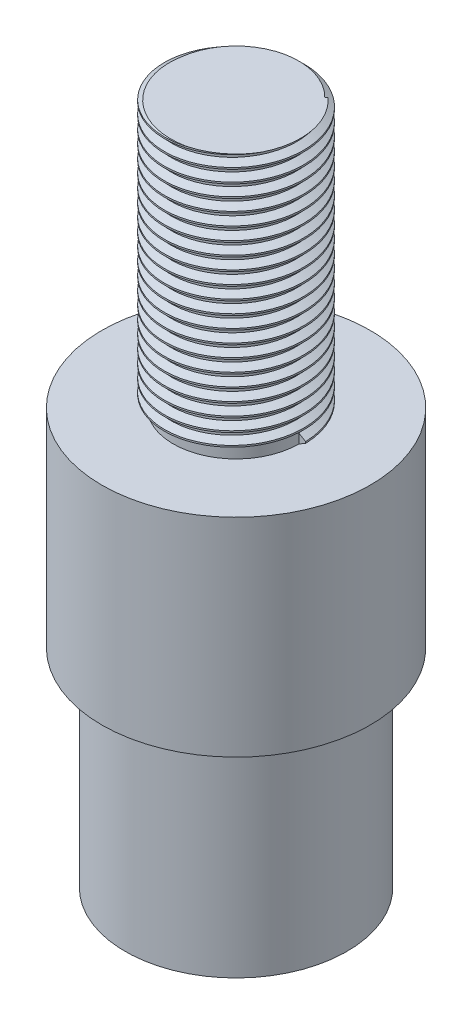
from build123d import *
from build123d.topology import SkipClean

# Parameters (mm, degrees)
SKETCH1_R           = 13.4493
BOSS_EXTRUDE1_DEPTH = 20.828
SKETCH2_R           = 11.1125
BOSS_EXTRUDE2_DEPTH = 20.828
SKETCH3_R           = 6.29285
BOSS_EXTRUDE3_DEPTH = 26.9621
THREAD1_PITCH       = 1.27
THREAD1_TO          = 26.9621


with BuildPart() as part:
    # Sketch1 → Boss-Extrude1 (new body)
    with BuildSketch(Plane(origin=(0, 0, 0), x_dir=(1, 0, 0), z_dir=(0, 1, 0))):
        with Locations(Location((0, 0, 0), (0, 0, 270))):
            Circle(SKETCH1_R)
    extrude(amount=BOSS_EXTRUDE1_DEPTH)

    # Sketch2 → Boss-Extrude2 (add)
    with BuildSketch(Plane(origin=(0, 0, 0), x_dir=(-1, 0, 0), z_dir=(0, -1, 0))):
        with Locations(Location((0, 0, 0), (0, 0, 90))):
            Circle(SKETCH2_R)
    extrude(amount=BOSS_EXTRUDE2_DEPTH)

    # Sketch3 → Boss-Extrude3 (add)
    with BuildSketch(Plane(origin=(0, 20.828, 0), x_dir=(1, 0, 0), z_dir=(0, 1, 0))):
        with Locations(Location((0, 0, 0), (0, 0, 270))):
            Circle(SKETCH3_R)
    extrude(amount=BOSS_EXTRUDE3_DEPTH)

    # Thread1: arcs per turn and ends read off the stored shape
    # Thread1: the profile of Thread Profile2 profile screwed along a right-hand helix through 21.124016 turns, 8 arcs to a turn; built about Z, then put on its axis
    with SkipClean():  # the faces are left unmerged after this step: merging them gives an invalid solid
        thread1_z = Axis((0, 0, 0), (0, 0, 1))
        thread1_corners = [(6.29255, 0, -0.000173205), (6.980257661, 0, 0.396874998), (6.980257661, 0, 0.555624998), (6.29255, 0, 0.952673202)]
        with BuildLine(mode=Mode.PRIVATE) as thread1_profile:
            Line(thread1_corners[0], thread1_corners[1])
            Line(thread1_corners[1], thread1_corners[2])
            Line(thread1_corners[2], thread1_corners[3])
            Line(thread1_corners[3], thread1_corners[0])
        thread1_cap = Face(thread1_profile.wire())
        thread1_turn_angles = [0, 22.5, 45, 67.5, 90, 112.5, 135, 157.5, 180, 202.5, 225, 247.5, 270, 292.5, 315, 337.5, 360]
        thread1_turn_weights = [1, 0.9238795325112867, 1, 0.9238795325112867, 1, 0.9238795325112867, 1, 0.9238795325112867, 1, 0.9238795325112867, 1, 0.9238795325112867, 1, 0.9238795325112867, 1, 0.9238795325112867, 1]
        thread1_turn_rails = [Edge.make_bspline([Vector(p[0], p[1], 0).rotate(thread1_z, thread1_turn_angles[k]) / thread1_turn_weights[k] + Vector(0, 0, p[2] + THREAD1_PITCH * thread1_turn_angles[k] / 360) for k in range(17)], [0, 0, 0, 1, 1, 2, 2, 3, 3, 4, 4, 5, 5, 6, 6, 7, 7, 8, 8, 8], 2, thread1_turn_weights) for p in thread1_corners]
        thread1_turn_sides = [Face.make_surface_from_curves(thread1_turn_rails[p[0]], thread1_turn_rails[p[1]]) for p in [(0, 1), (1, 2), (2, 3), (3, 0)]]
        thread1_last_angles = [7560, 7582.322834646, 7604.645669291]
        thread1_last_weights = [1, 0.9250584165493119, 1]
        thread1_last_rails = [Edge.make_bspline([Vector(p[0], p[1], 0).rotate(thread1_z, thread1_last_angles[k]) / thread1_last_weights[k] + Vector(0, 0, p[2] + THREAD1_PITCH * thread1_last_angles[k] / 360) for k in range(3)], [0, 0, 0, 1, 1, 1], 2, thread1_last_weights) for p in thread1_corners]
        thread1_last_sides = [Face.make_surface_from_curves(thread1_last_rails[p[0]], thread1_last_rails[p[1]]) for p in [(0, 1), (1, 2), (2, 3), (3, 0)]]
        thread1 = Plane(origin=(0, 20.828, 0), x_dir=(1, 0, 0), z_dir=(0, 1, 0)) * split(Solid(Shell([*[p.moved(Location((0, 0, THREAD1_PITCH * i))) for i in range(21) for p in thread1_turn_sides], *thread1_last_sides, thread1_cap, thread1_cap.rotate(thread1_z, 7604.645669291).moved(Location((0, 0, THREAD1_PITCH * 7604.645669291 / 360)))])), bisect_by=Plane.XY.offset(THREAD1_TO), keep=Keep.BOTTOM, mode=Mode.PRIVATE)
        add(thread1)


solid = part.part
